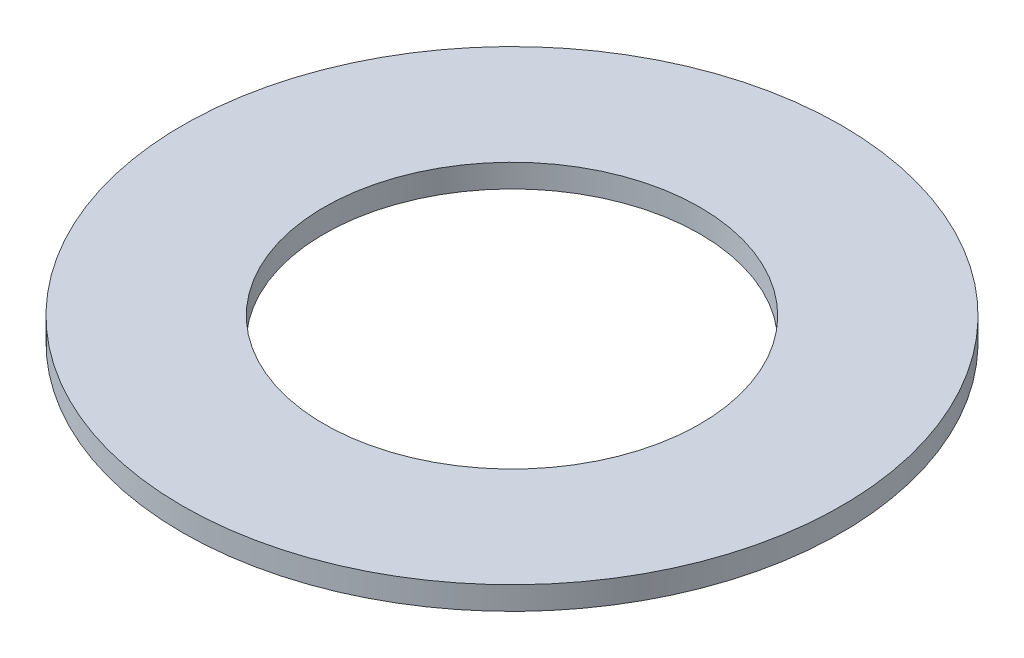
from build123d import *

# Parameters (mm, degrees)
SKETCH1_W = 24.5
SKETCH1_H = 4


with BuildPart() as part:
    # Sketch1 → Revolve1 (revolve)
    with BuildSketch(Plane.XY):
        with Locations((44.75, 0)):
            Rectangle(SKETCH1_W, SKETCH1_H)
    revolve(axis=Axis((0, 0, 0), (0, 1, 0)))


solid = part.part
